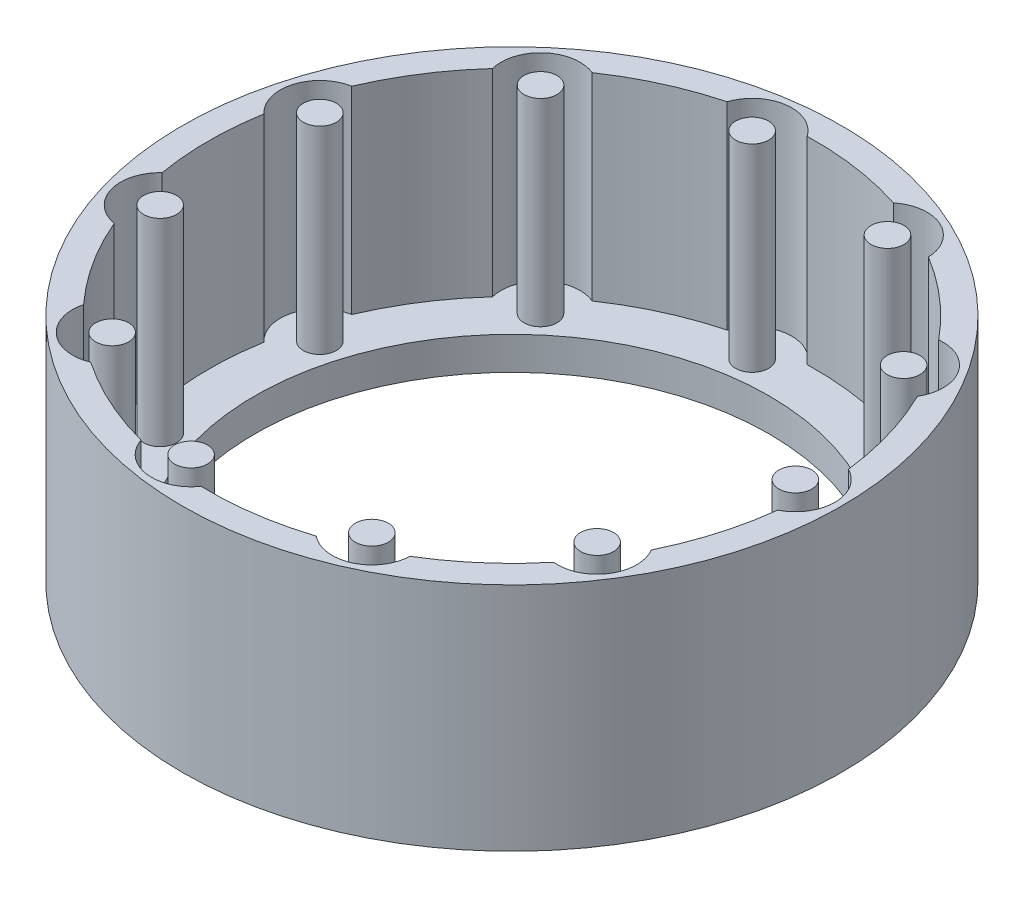
from build123d import *

# Parameters (mm, degrees)
SKETCH1_R               = 50
BOSS_EXTRUDE1_DEPTH     = 5
SKETCH2_R               = 2.5
BOSS_EXTRUDE2_DEPTH     = 30
BOSS_EXTRUDE3_OUTLINE_R = 50
BOSS_EXTRUDE3_DEPTH     = 30
SKETCH4_R               = 39
CUT_EXTRUDE1_DEPTH      = 6


# Read off the part's stored shape, not the designer's step: Boss-Extrude3
with BuildPart() as part:
    # Sketch1 → Boss-Extrude1 (new body)
    with BuildSketch(Plane(origin=(0, 0, 0), x_dir=(1, 0, 0), z_dir=(0, 1, 0))):
        with Locations(Location((0, 0, 0), (0, 0, 270))):
            Circle(SKETCH1_R)
    extrude(amount=BOSS_EXTRUDE1_DEPTH)

    # Sketch2 → Boss-Extrude2 (add)
    with BuildSketch(Plane(origin=(0, 5, 0), x_dir=(1, 0, 0), z_dir=(0, 1, 0))):
        with Locations(Location((43, 0, 0), (0, 0, 270))):
            Circle(SKETCH2_R)
        with Locations(Location((36.173901912, -23.247555151, 0), (0, 0, 270))):
            Circle(SKETCH2_R)
        with Locations(Location((17.862845559, -39.1141758, 0), (0, 0, 270))):
            Circle(SKETCH2_R)
        with Locations(Location((-6.119538046, -42.562322001, 0), (0, 0, 270))):
            Circle(SKETCH2_R)
        with Locations(Location((-28.15901156, -32.497231697, 0), (0, 0, 270))):
            Circle(SKETCH2_R)
        with Locations(Location((-41.258197865, -12.114499944, 0), (0, 0, 270))):
            Circle(SKETCH2_R)
        with Locations(Location((-41.258197865, 12.114499944, 0), (0, 0, 270))):
            Circle(SKETCH2_R)
        with Locations(Location((-28.15901156, 32.497231697, 0), (0, 0, 270))):
            Circle(SKETCH2_R)
        with Locations(Location((-6.119538046, 42.562322001, 0), (0, 0, 270))):
            Circle(SKETCH2_R)
        with Locations(Location((17.862845559, 39.1141758, 0), (0, 0, 270))):
            Circle(SKETCH2_R)
        with Locations(Location((36.173901912, 23.247555151, 0), (0, 0, 270))):
            Circle(SKETCH2_R)
    extrude(amount=BOSS_EXTRUDE2_DEPTH)

    # Boss-Extrude3 outline → Boss-Extrude3 (add)
    with BuildSketch(Plane(origin=(0, 5, 0), x_dir=(1, 0, 0), z_dir=(0, 1, 0))):
        Circle(BOSS_EXTRUDE3_OUTLINE_R)
        with BuildLine():
            ThreePointArc((45.686046512, 5.365179786), (49, 0), (45.686046512, -5.365179786))
            ThreePointArc((45.686046512, -5.365179786), (44.136676786, -12.959697615), (41.334183214, -20.186265083))
            ThreePointArc((41.334183214, -20.186265083), (41.221423109, -26.491400055), (35.532912844, -29.213217982))
            ThreePointArc((35.532912844, -29.213217982), (30.123593761, -34.76448042), (23.8590088, -39.328713418))
            ThreePointArc((23.8590088, -39.328713418), (20.355335637, -44.571967772), (14.098330411, -43.786265879))
            ThreePointArc((14.098330411, -43.786265879), (6.54648256, -45.531786327), (-1.191232329, -45.984573126))
            ThreePointArc((-1.191232329, -45.984573126), (-6.973427076, -48.501250652), (-11.812372312, -44.457483738))
            ThreePointArc((-11.812372312, -44.457483738), (-19.109090598, -41.843071786), (-25.86326561, -38.040655778))
            ThreePointArc((-25.86326561, -38.040655778), (-32.088175963, -37.031729143), (-33.972730289, -31.013764633))
            ThreePointArc((-33.972730289, -31.013764633), (-38.69766251, -24.869477603), (-42.323894801, -18.019099003))
            ThreePointArc((-42.323894801, -18.019099003), (-47.015155707, -13.804895285), (-45.346986439, -7.723394389))
            ThreePointArc((-45.346986439, -7.723394389), (-46, 0), (-45.346986439, 7.723394389))
            ThreePointArc((-45.346986439, 7.723394389), (-47.015155707, 13.804895285), (-42.323894801, 18.019099003))
            ThreePointArc((-42.323894801, 18.019099003), (-38.69766251, 24.869477603), (-33.972730289, 31.013764633))
            ThreePointArc((-33.972730289, 31.013764633), (-32.088175963, 37.031729143), (-25.86326561, 38.040655778))
            ThreePointArc((-25.86326561, 38.040655778), (-19.109090598, 41.843071786), (-11.812372312, 44.457483738))
            ThreePointArc((-11.812372312, 44.457483738), (-6.973427076, 48.501250652), (-1.191232329, 45.984573126))
            ThreePointArc((-1.191232329, 45.984573126), (6.54648256, 45.531786327), (14.098330411, 43.786265879))
            ThreePointArc((14.098330411, 43.786265879), (20.355335637, 44.571967772), (23.8590088, 39.328713418))
            ThreePointArc((23.8590088, 39.328713418), (30.123593761, 34.76448042), (35.532912844, 29.213217982))
            ThreePointArc((35.532912844, 29.213217982), (41.221423109, 26.491400055), (41.334183214, 20.186265083))
            ThreePointArc((41.334183214, 20.186265083), (44.136676786, 12.959697615), (45.686046512, 5.365179786))
        make_face(mode=Mode.SUBTRACT)
    extrude(amount=BOSS_EXTRUDE3_DEPTH)

    # Sketch4 → Cut-Extrude1 (cut)
    with BuildSketch(Plane(origin=(0, 5, 0), x_dir=(1, 0, 0), z_dir=(0, 1, 0))):
        with Locations(Location((0, 0, 0), (0, 0, 270))):
            Circle(SKETCH4_R)
    extrude(amount=-CUT_EXTRUDE1_DEPTH, mode=Mode.SUBTRACT)


solid = part.part
